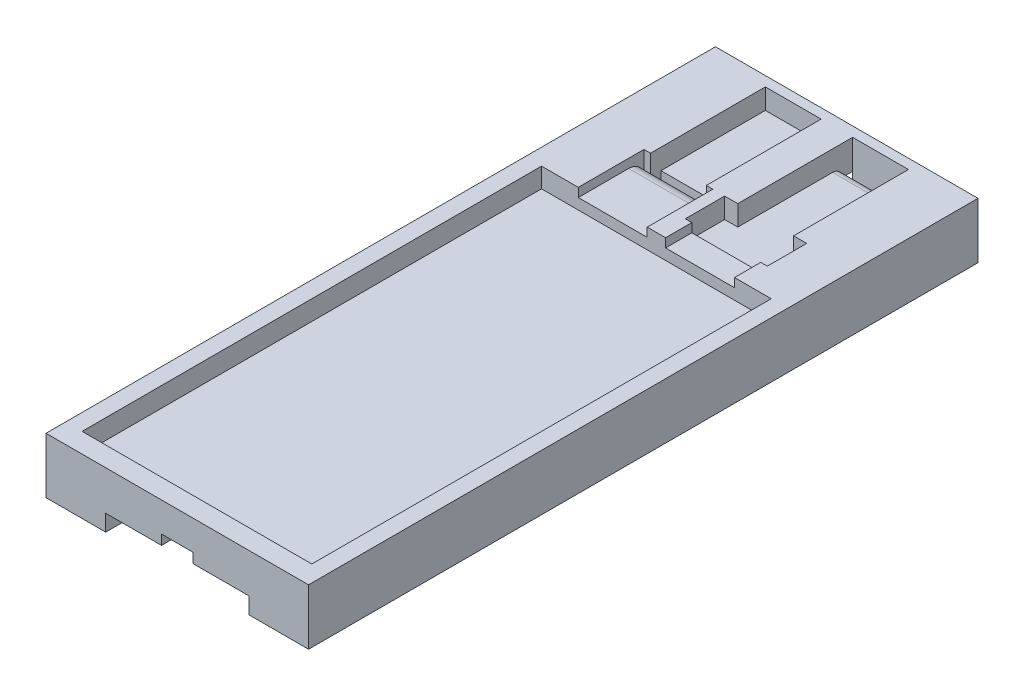
from build123d import *

# Parameters (mm, degrees)
SKETCH1_W               = 40
SKETCH1_H               = 102
BOSS_EXTRUDE1_DEPTH     = 8.5
SKETCH2_W               = 35
SKETCH2_H               = 70
CUT_EXTRUDE1_DEPTH      = 3
SKETCH3_W               = 10.5
SKETCH3_H               = 10
CUT_EXTRUDE2_DEPTH      = 1.35
SKETCH4_W               = 12.5
SKETCH4_H               = 6
CUT_EXTRUDE3_DEPTH      = 3.1
SKETCH5_W               = 8.5
SKETCH5_H               = 17.5
PCB_PLACE_DEPTH         = 3.1
SKETCH6_W               = 8.5
SKETCH6_H               = 1.6
NICKEL_STRIP_HOLE_DEPTH = 66.369411807
CUT_EXTRUDE4_REACH      = 67.698
SKETCH7_W               = 8.5
SKETCH7_H               = 17.5
SKETCH8_W               = 8.5
SKETCH8_H               = 1.6
CUT_EXTRUDE5_DEPTH      = 10
SKETCH9_W               = 8.5
SKETCH9_H               = 102
NICKEL_STRIP_RAIL_DEPTH = 2.5
FILLET3_R               = 2.325
FILLET4_RADIUS          = 1.45
FILLET4_LENGTH          = 8.5
CUT_EXTRUDE6_REACH      = 106.289
SKETCH10_W              = 4.8
SKETCH10_H              = 4


with BuildPart() as part:
    # Sketch1 → Boss-Extrude1 (new body)
    with BuildSketch(Plane(origin=(0, 0, 0), x_dir=(1, 0, 0), z_dir=(0, 1, 0))):
        with Locations((0, 11)):
            Rectangle(SKETCH1_W, SKETCH1_H)
    extrude(amount=BOSS_EXTRUDE1_DEPTH)

    # Sketch2 → Cut-Extrude1 (cut)
    with BuildSketch(Plane(origin=(0, 8.5, 0), x_dir=(1, 0, 0), z_dir=(0, 1, 0))):
        with Locations((0, -2)):
            Rectangle(SKETCH2_W, SKETCH2_H)
    extrude(amount=-CUT_EXTRUDE1_DEPTH, mode=Mode.SUBTRACT)

    # Sketch3 → Cut-Extrude2 (cut)
    with BuildSketch(Plane(origin=(0, 8.5, 0), x_dir=(1, 0, 0), z_dir=(0, 1, 0))):
        with Locations((-6.65, 38)):
            Rectangle(SKETCH3_W, SKETCH3_H)
        with Locations((6.65, 38)):
            Rectangle(SKETCH3_W, SKETCH3_H)
    extrude(amount=-CUT_EXTRUDE2_DEPTH, mode=Mode.SUBTRACT)

    # Sketch4 → Cut-Extrude3 (cut)
    with BuildSketch(Plane(origin=(0, 8.5, 0), x_dir=(1, 0, 0), z_dir=(0, 1, 0))):
        with Locations((6.65, 40)):
            Rectangle(SKETCH4_W, SKETCH4_H)
    extrude(amount=-CUT_EXTRUDE3_DEPTH, mode=Mode.SUBTRACT)

    # Sketch5 → PCB place (cut)
    with BuildSketch(Plane(origin=(0, 8.5, 0), x_dir=(1, 0, 0), z_dir=(0, 1, 0))):
        with Locations((6.65, 51.75)):
            Rectangle(SKETCH5_W, SKETCH5_H)
    extrude(amount=-PCB_PLACE_DEPTH, mode=Mode.SUBTRACT)

    # Sketch6 → Nickel strip hole (cut, through all)
    with BuildSketch(Plane(origin=(0, 5.4, 0), x_dir=(1, 0, 0), z_dir=(0, 1, 0))):
        with Locations((6.65, 59.7)):
            Rectangle(SKETCH6_W, SKETCH6_H)
    extrude(amount=-NICKEL_STRIP_HOLE_DEPTH, mode=Mode.SUBTRACT)

    # Cut-Extrude4: up to this face of the body (flat: up to its plane)
    cut_extrude4_end = Plane(part.part.faces().sort_by_distance((6.65, 5.4, -47.042077088))[0])
    # Sketch7 → Cut-Extrude4 (cut, up to the picked face)
    with BuildSketch(Plane(origin=(0, 8.5, 0), x_dir=(1, 0, 0), z_dir=(0, 1, 0)), mode=Mode.PRIVATE) as cut_extrude4_sk1:
        with Locations((-6.65, 51.75)):
            Rectangle(SKETCH7_W, SKETCH7_H)
    cut_extrude4_tool1 = split(extrude(cut_extrude4_sk1.sketch, amount=-CUT_EXTRUDE4_REACH, mode=Mode.PRIVATE), bisect_by=cut_extrude4_end, keep=Keep.BOTH, mode=Mode.PRIVATE)
    add(cut_extrude4_tool1.solids().sort_by(Axis((-6.65, 8.5, -51.75), (0, -1, 0)))[0], mode=Mode.SUBTRACT)

    # Sketch8 → Cut-Extrude5 (cut)
    with BuildSketch(Plane(origin=(0, 5.4, 0), x_dir=(1, 0, 0), z_dir=(0, 1, 0))):
        with Locations((-6.65, 43.8)):
            Rectangle(SKETCH8_W, SKETCH8_H)
    extrude(amount=-CUT_EXTRUDE5_DEPTH, mode=Mode.SUBTRACT)

    # Sketch9 → Nickel strip rail (cut)
    with BuildSketch(Plane.XZ):
        with Locations((-6.65, -11)):
            Rectangle(SKETCH9_W, SKETCH9_H)
        with Locations((6.65, -11)):
            Rectangle(SKETCH9_W, SKETCH9_H)
    extrude(amount=-NICKEL_STRIP_RAIL_DEPTH, mode=Mode.SUBTRACT)

    # Fillet3
    # the kernel refuses this fillet: 2.325 mm, written as the material it takes off along each edge
    with BuildSketch(Plane(origin=(3.4125, 7.15, -43), x_dir=(0, 0, 1), z_dir=(-1, 0, 0))) as fillet3_piece_1_section:
        with BuildLine():
            CenterArc((FILLET3_R, -FILLET3_R), FILLET3_R, 90, 90)
            Line((0, -FILLET3_R), (0, 0))
            Line((0, 0), (FILLET3_R, 0))
        make_face()
    fillet3_piece_1 = extrude(amount=20.125, mode=Mode.PRIVATE)
    fillet3_piece_1 = split(fillet3_piece_1, bisect_by=Plane(origin=(-11.9, 7.15, -43), z_dir=(1, 0, 0)), keep=Keep.TOP, mode=Mode.PRIVATE)
    fillet3_piece_1 = split(fillet3_piece_1, bisect_by=Plane(origin=(-1.4, 7.15, -43), z_dir=(-1, 0, 0)), keep=Keep.TOP, mode=Mode.PRIVATE)
    add(fillet3_piece_1, mode=Mode.SUBTRACT)
    with BuildSketch(Plane(origin=(-10.9, 2.5, -43), x_dir=(0, 1, 0), z_dir=(1, 0, 0))) as fillet3_piece_2:
        with BuildLine():
            CenterArc((FILLET3_R, FILLET3_R), FILLET3_R, 180, 90)
            Line((0, FILLET3_R), (0, 0))
            Line((0, 0), (FILLET3_R, 0))
        make_face()
    extrude(amount=8.5, mode=Mode.SUBTRACT)

    # Fillet4: full round fillet: the end face becomes a half cylinder, R = half its width
    fillet4_face = Plane((6.65, 3.95, -58.9), x_dir=(-1, 0, 0), z_dir=(0, 0, -1))  # on the end face: x along it, z out of the body
    fillet4_slab = fillet4_face.offset(-FILLET4_RADIUS / 2) * Box(FILLET4_LENGTH, 2 * FILLET4_RADIUS, FILLET4_RADIUS, mode=Mode.PRIVATE)  # the body's end, R deep
    fillet4_round = Plane((6.65, 3.95, -57.45), x_dir=(0, 0, -1), z_dir=(-1, 0, 0)) * Cylinder(FILLET4_RADIUS, FILLET4_LENGTH, mode=Mode.PRIVATE)  # its axis R under the face
    add(fillet4_slab - fillet4_round, mode=Mode.SUBTRACT)

    # Cut-Extrude6: up to this face of the body (flat: up to its plane)
    cut_extrude6_end = Plane(part.part.faces().sort_by_distance((0, 4.678571429, -62))[0])
    # Sketch10 → Cut-Extrude6 (cut, up to the picked face)
    with BuildSketch(Plane.XY.offset(40), mode=Mode.PRIVATE) as cut_extrude6_sk1:
        with Locations((0, 2)):
            Rectangle(SKETCH10_W, SKETCH10_H)
    cut_extrude6_tool1 = split(extrude(cut_extrude6_sk1.sketch, amount=-CUT_EXTRUDE6_REACH, mode=Mode.PRIVATE), bisect_by=cut_extrude6_end, keep=Keep.BOTH, mode=Mode.PRIVATE)
    add(cut_extrude6_tool1.solids().sort_by(Axis((0, 2, 40), (0, 0, -1)))[0], mode=Mode.SUBTRACT)


solid = part.part
